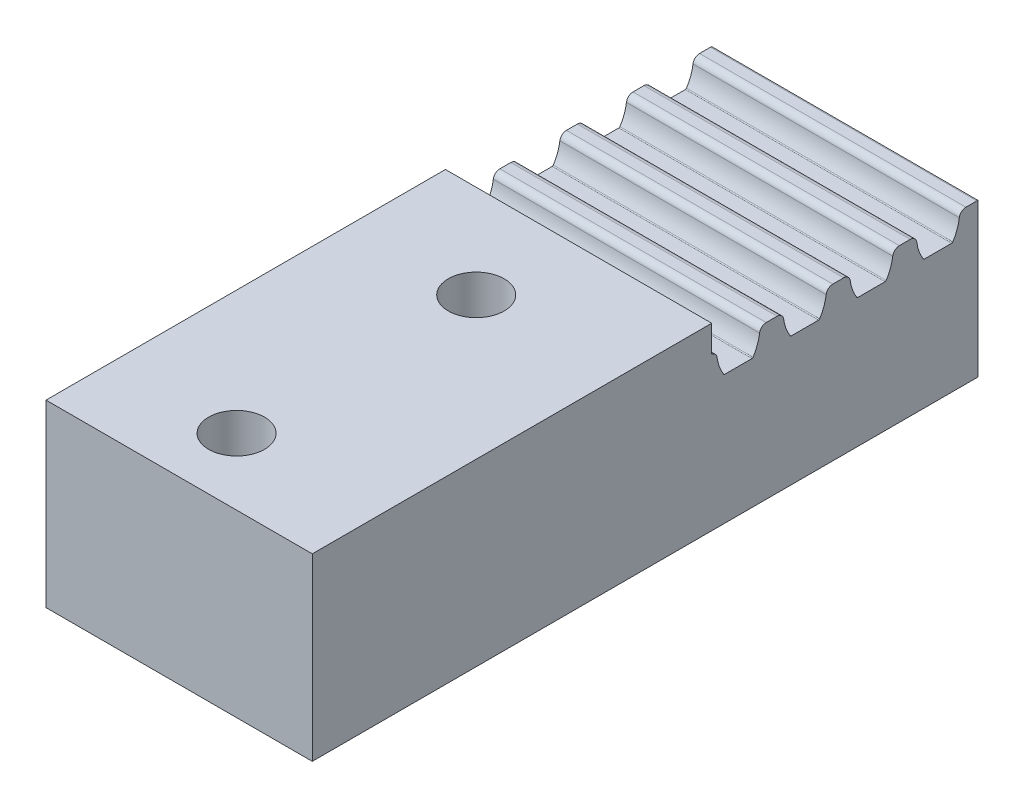
from build123d import *

# Parameters (mm, degrees)
DELETE_START           = -13.5
DELETE_FACE_1_DEPTH    = 27
MOVE_FACE_1_BY         = 7
MOVE_FACE_2_BY         = 5.5
SKETCH_2_W             = 48.263019836
SKETCH_2_H             = 43.058184364
CUT_EXTRUDE_1_DEPTH    = 20
EXTRUDE_1_DEPTH        = 2
EXTRUDE_1_DEPTH_BACK   = 5
SKETCH_3_W             = 20
SKETCH_3_H             = 30
HOLE_WIZARD_M5_1_D     = 4.2
HOLE_WIZARD_M5_1_DEPTH = 20
HOLE_WIZARD_M5_1_TIP   = 1.2618073


with BuildPart() as part:
    # Delete Face 1: read off the stored shape, not the designer's step
    # Delete Face 1 outline → Delete Face 1 (new body)
    with BuildSketch(Plane.YZ.offset(DELETE_START)):
        with BuildLine():
            ThreePointArc((-8.364285714, 23.895568572), (-8.397831007, 23.931741933), (-8.41, 23.979551078))
            Line((-8.41, 23.979551078), (-8.41, 26.020448922))
            ThreePointArc((-8.41, 26.020448922), (-8.397831007, 26.068258067), (-8.364285714, 26.104431428))
            ThreePointArc((-8.364285714, 26.104431428), (-7.725958169, 26.423724028), (-7.033327746, 26.595982314))
            ThreePointArc((-7.033327746, 26.595982314), (-6.723611818, 26.762379014), (-6.6, 27.091517187))
            Line((-6.6, 27.091517187), (-6.6, 27.908482813))
            ThreePointArc((-6.6, 27.908482813), (-6.723615527, 28.237625227), (-7.033338915, 28.404019189))
            ThreePointArc((-7.033338915, 28.404019189), (-7.725963455, 28.576277924), (-8.364285714, 28.895568572))
            ThreePointArc((-8.364285714, 28.895568572), (-8.397831007, 28.931741933), (-8.41, 28.979551078))
            Line((-8.41, 28.979551078), (-8.41, 31.020448922))
            ThreePointArc((-8.41, 31.020448922), (-8.397831007, 31.068258067), (-8.364285714, 31.104431428))
            ThreePointArc((-8.364285714, 31.104431428), (-7.725958168, 31.423724029), (-7.033327744, 31.595982314))
            ThreePointArc((-7.033327744, 31.595982314), (-6.723611817, 31.762379015), (-6.6, 32.091517187))
            Line((-6.6, 32.091517187), (-6.6, 32.908482813))
            ThreePointArc((-6.6, 32.908482813), (-6.602116164, 32.954435895), (-6.608446743, 33))
            Line((-6.608446743, 33), (-12.6, 33))
            Line((-12.6, 33), (-12.6, -33))
            Line((-12.6, -33), (-6.608446743, -33))
            ThreePointArc((-6.608446743, -33), (-6.602116164, -32.954435895), (-6.6, -32.908482813))
            Line((-6.6, -32.908482813), (-6.6, -32.091517187))
            ThreePointArc((-6.6, -32.091517187), (-6.723615531, -31.762374768), (-7.033338927, -31.595980809))
            ThreePointArc((-7.033338927, -31.595980809), (-7.72596346, -31.423722074), (-8.364285714, -31.104431428))
            ThreePointArc((-8.364285714, -31.104431428), (-8.397831007, -31.068258067), (-8.41, -31.020448922))
            Line((-8.41, -31.020448922), (-8.41, -28.979551078))
            ThreePointArc((-8.41, -28.979551078), (-8.397831007, -28.931741933), (-8.364285714, -28.895568572))
            ThreePointArc((-8.364285714, -28.895568572), (-7.725958168, -28.576275971), (-7.033327744, -28.404017686))
            ThreePointArc((-7.033327744, -28.404017686), (-6.723611817, -28.237620985), (-6.6, -27.908482813))
            Line((-6.6, -27.908482813), (-6.6, -27.091517187))
            ThreePointArc((-6.6, -27.091517187), (-6.723615528, -26.762374772), (-7.033338917, -26.595980811))
            ThreePointArc((-7.033338917, -26.595980811), (-7.725963456, -26.423722076), (-8.364285714, -26.104431428))
            ThreePointArc((-8.364285714, -26.104431428), (-8.397831007, -26.068258067), (-8.41, -26.020448922))
            Line((-8.41, -26.020448922), (-8.41, -23.979551078))
            ThreePointArc((-8.41, -23.979551078), (-8.397831007, -23.931741933), (-8.364285714, -23.895568572))
            ThreePointArc((-8.364285714, -23.895568572), (-7.725958169, -23.576275972), (-7.033327746, -23.404017686))
            ThreePointArc((-7.033327746, -23.404017686), (-6.723611818, -23.237620986), (-6.6, -22.908482813))
            Line((-6.6, -22.908482813), (-6.6, -22.091517187))
            ThreePointArc((-6.6, -22.091517187), (-6.723615529, -21.76237477), (-7.033338921, -21.59598081))
            ThreePointArc((-7.033338921, -21.59598081), (-7.725963458, -21.423722075), (-8.364285714, -21.104431428))
            ThreePointArc((-8.364285714, -21.104431428), (-8.397831007, -21.068258067), (-8.41, -21.020448922))
            Line((-8.41, -21.020448922), (-8.41, -18.979551078))
            ThreePointArc((-8.41, -18.979551078), (-8.397831007, -18.931741933), (-8.364285714, -18.895568572))
            ThreePointArc((-8.364285714, -18.895568572), (-7.725958168, -18.576275971), (-7.033327744, -18.404017686))
            ThreePointArc((-7.033327744, -18.404017686), (-6.723611817, -18.237620985), (-6.6, -17.908482813))
            Line((-6.6, -17.908482813), (-6.6, -17.091517187))
            ThreePointArc((-6.6, -17.091517187), (-6.723615531, -16.762374768), (-7.033338926, -16.595980809))
            ThreePointArc((-7.033338926, -16.595980809), (-7.72596346, -16.423722074), (-8.364285714, -16.104431428))
            ThreePointArc((-8.364285714, -16.104431428), (-8.397831007, -16.068258067), (-8.41, -16.020448922))
            Line((-8.41, -16.020448922), (-8.41, -13.979551078))
            ThreePointArc((-8.41, -13.979551078), (-8.397831007, -13.931741933), (-8.364285714, -13.895568572))
            ThreePointArc((-8.364285714, -13.895568572), (-7.725958337, -13.576276034), (-7.033328102, -13.404017734))
            ThreePointArc((-7.033328102, -13.404017734), (-6.723611936, -13.237621121), (-6.6, -12.908482813))
            Line((-6.6, -12.908482813), (-6.6, -12.091517187))
            ThreePointArc((-6.6, -12.091517187), (-6.723615532, -11.762374767), (-7.033338929, -11.595980809))
            ThreePointArc((-7.033338929, -11.595980809), (-7.725963462, -11.423722074), (-8.364285714, -11.104431428))
            ThreePointArc((-8.364285714, -11.104431428), (-8.397831007, -11.068258067), (-8.41, -11.020448922))
            Line((-8.41, -11.020448922), (-8.41, -8.979551078))
            ThreePointArc((-8.41, -8.979551078), (-8.397831007, -8.931741933), (-8.364285714, -8.895568572))
            ThreePointArc((-8.364285714, -8.895568572), (-7.725958524, -8.576276103), (-7.033328496, -8.404017787))
            ThreePointArc((-7.033328496, -8.404017787), (-6.723612067, -8.23762127), (-6.6, -7.908482813))
            Line((-6.6, -7.908482813), (-6.6, -7.091517187))
            ThreePointArc((-6.6, -7.091517187), (-6.723615306, -6.762375026), (-7.033338249, -6.595980901))
            ThreePointArc((-7.033338249, -6.595980901), (-7.72596314, -6.423722193), (-8.364285714, -6.104431428))
            ThreePointArc((-8.364285714, -6.104431428), (-8.397831007, -6.068258067), (-8.41, -6.020448922))
            Line((-8.41, -6.020448922), (-8.41, -3.979551078))
            ThreePointArc((-8.41, -3.979551078), (-8.397831007, -3.931741933), (-8.364285714, -3.895568572))
            ThreePointArc((-8.364285714, -3.895568572), (-7.725958462, -3.57627608), (-7.033328366, -3.40401777))
            ThreePointArc((-7.033328366, -3.40401777), (-6.723612024, -3.237621221), (-6.6, -2.908482813))
            Line((-6.6, -2.908482813), (-6.6, -2.091517187))
            ThreePointArc((-6.6, -2.091517187), (-6.723615307, -1.762375024), (-7.033338252, -1.5959809))
            ThreePointArc((-7.033338252, -1.5959809), (-7.725963141, -1.423722192), (-8.364285714, -1.104431428))
            ThreePointArc((-8.364285714, -1.104431428), (-8.397831007, -1.068258067), (-8.41, -1.020448922))
            Line((-8.41, -1.020448922), (-8.41, 1.020448922))
            ThreePointArc((-8.41, 1.020448922), (-8.397831007, 1.068258067), (-8.364285714, 1.104431428))
            ThreePointArc((-8.364285714, 1.104431428), (-7.725958462, 1.42372392), (-7.033328366, 1.59598223))
            ThreePointArc((-7.033328366, 1.59598223), (-6.723612024, 1.762378779), (-6.6, 2.091517187))
            Line((-6.6, 2.091517187), (-6.6, 2.908482813))
            ThreePointArc((-6.6, 2.908482813), (-6.723615307, 3.237624975), (-7.033338252, 3.4040191))
            ThreePointArc((-7.033338252, 3.4040191), (-7.725963141, 3.576277808), (-8.364285714, 3.895568572))
            ThreePointArc((-8.364285714, 3.895568572), (-8.397831007, 3.931741933), (-8.41, 3.979551078))
            Line((-8.41, 3.979551078), (-8.41, 6.020448922))
            ThreePointArc((-8.41, 6.020448922), (-8.397831007, 6.068258067), (-8.364285714, 6.104431428))
            ThreePointArc((-8.364285714, 6.104431428), (-7.725958469, 6.423723918), (-7.03332838, 6.595982228))
            ThreePointArc((-7.03332838, 6.595982228), (-6.723612029, 6.762378774), (-6.6, 7.091517187))
            Line((-6.6, 7.091517187), (-6.6, 7.908482813))
            ThreePointArc((-6.6, 7.908482813), (-6.723615311, 8.23762498), (-7.033338263, 8.404019101))
            ThreePointArc((-7.033338263, 8.404019101), (-7.725963146, 8.57627781), (-8.364285714, 8.895568572))
            ThreePointArc((-8.364285714, 8.895568572), (-8.397831007, 8.931741933), (-8.41, 8.979551078))
            Line((-8.41, 8.979551078), (-8.41, 11.020448922))
            ThreePointArc((-8.41, 11.020448922), (-8.397831007, 11.068258067), (-8.364285714, 11.104431428))
            ThreePointArc((-8.364285714, 11.104431428), (-7.725958337, 11.423723966), (-7.033328101, 11.595982266))
            ThreePointArc((-7.033328101, 11.595982266), (-6.723611936, 11.76237888), (-6.6, 12.091517187))
            Line((-6.6, 12.091517187), (-6.6, 12.908482813))
            ThreePointArc((-6.6, 12.908482813), (-6.72361553, 13.237625231), (-7.033338924, 13.40401919))
            ThreePointArc((-7.033338924, 13.40401919), (-7.725963459, 13.576277925), (-8.364285714, 13.895568572))
            ThreePointArc((-8.364285714, 13.895568572), (-8.397831007, 13.931741933), (-8.41, 13.979551078))
            Line((-8.41, 13.979551078), (-8.41, 16.020448922))
            ThreePointArc((-8.41, 16.020448922), (-8.397831007, 16.068258067), (-8.364285714, 16.104431428))
            ThreePointArc((-8.364285714, 16.104431428), (-7.725958169, 16.423724029), (-7.033327745, 16.595982314))
            ThreePointArc((-7.033327745, 16.595982314), (-6.723611818, 16.762379015), (-6.6, 17.091517187))
            Line((-6.6, 17.091517187), (-6.6, 17.908482813))
            ThreePointArc((-6.6, 17.908482813), (-6.72361553, 18.23762523), (-7.033338923, 18.40401919))
            ThreePointArc((-7.033338923, 18.40401919), (-7.725963459, 18.576277925), (-8.364285714, 18.895568572))
            ThreePointArc((-8.364285714, 18.895568572), (-8.397831007, 18.931741933), (-8.41, 18.979551078))
            Line((-8.41, 18.979551078), (-8.41, 21.020448922))
            ThreePointArc((-8.41, 21.020448922), (-8.397831007, 21.068258067), (-8.364285714, 21.104431428))
            ThreePointArc((-8.364285714, 21.104431428), (-7.725958168, 21.423724029), (-7.033327744, 21.595982314))
            ThreePointArc((-7.033327744, 21.595982314), (-6.723611817, 21.762379015), (-6.6, 22.091517187))
            Line((-6.6, 22.091517187), (-6.6, 22.908482813))
            ThreePointArc((-6.6, 22.908482813), (-6.723615528, 23.237625227), (-7.033338915, 23.404019189))
            ThreePointArc((-7.033338915, 23.404019189), (-7.725963455, 23.576277924), (-8.364285714, 23.895568572))
        make_face()
    extrude(amount=DELETE_FACE_1_DEPTH)

    # Move Face 1: a face moved inward by 7.0
    extrude(part.faces().sort_by_distance((13.5, -10.05864991, 0))[0], amount=MOVE_FACE_1_BY, dir=(-1, 0, 0), mode=Mode.SUBTRACT)

    # Move Face 2: a face moved outward by 5.5
    extrude(part.faces().sort_by_distance((-3.5, -12.6, 0))[0], amount=MOVE_FACE_2_BY, dir=(0, -1, 0))

    # 草图2 → 切除-拉伸1 (cut)
    with BuildSketch(Plane.XZ.offset(18.1)):
        with Locations((-0.503276546, 38.529092182)):
            Rectangle(SKETCH_2_W, SKETCH_2_H)
    extrude(amount=-CUT_EXTRUDE_1_DEPTH, mode=Mode.SUBTRACT)

    # 草图3 → 凸台-拉伸1 (add, two sides: drawn at the far end of the back side and taken through both)
    with BuildSketch(Plane(origin=(0, -6.6, 0), x_dir=(1, 0, 0), z_dir=(0, 1, 0)).offset(-EXTRUDE_1_DEPTH_BACK)):
        with Locations((-3.5, -2)):
            Rectangle(SKETCH_3_W, SKETCH_3_H)
    extrude(amount=EXTRUDE_1_DEPTH + EXTRUDE_1_DEPTH_BACK)

    # M5 螺纹孔1
    with Locations(Plane(origin=(-4.186814404, -18.1, 12), x_dir=(0, 0, -1), z_dir=(0, -1, 0))):
        with Locations((0, 0), (18, 0)):
            Hole(HOLE_WIZARD_M5_1_D / 2, depth=HOLE_WIZARD_M5_1_DEPTH)
            with Locations((0, 0, -(HOLE_WIZARD_M5_1_DEPTH + HOLE_WIZARD_M5_1_TIP / 2))):  # 118° drill point
                Cone(0, HOLE_WIZARD_M5_1_D / 2, HOLE_WIZARD_M5_1_TIP, mode=Mode.SUBTRACT)


solid = part.part
